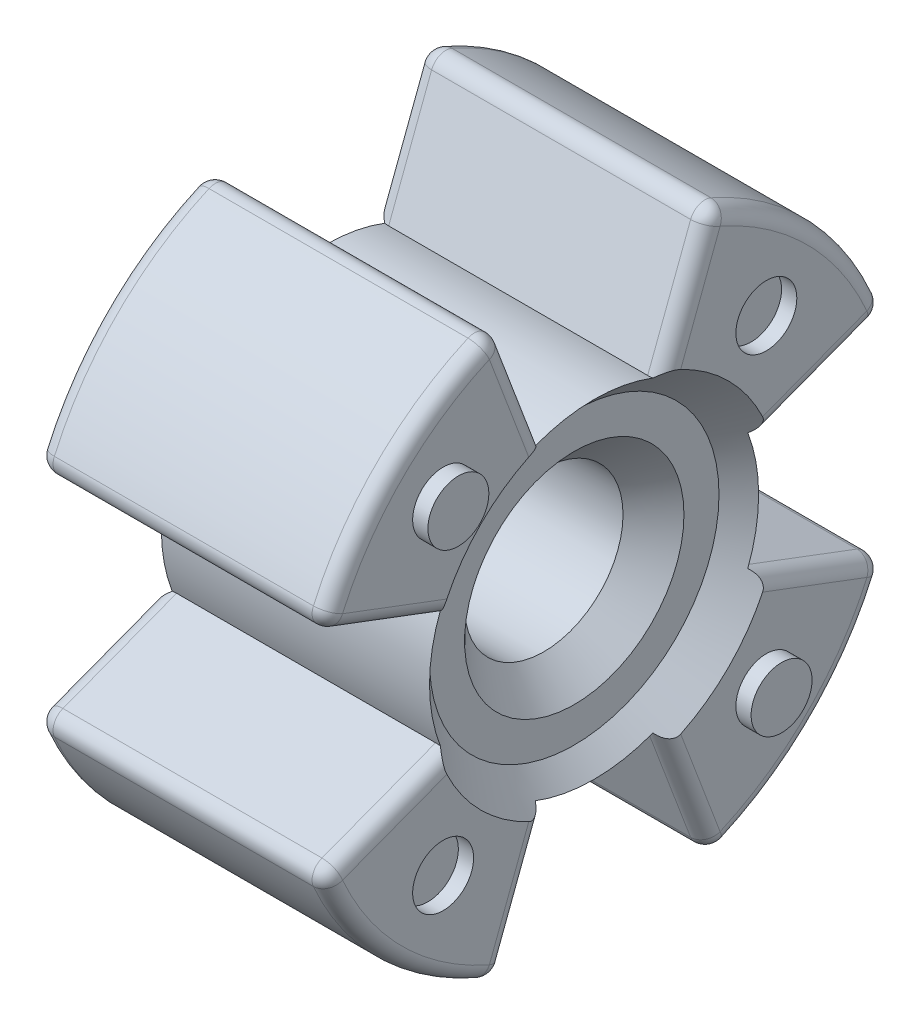
from build123d import *

# Parameters (mm, degrees)
EXTRUDE_1_DEPTH     = 4.75
FILLET_3_R          = 0.5
FILLET_2_R          = 0.5
SKETCH_2_R          = 2.6
CUT_EXTRUDE_1_DEPTH = 17.000196485
SKETCH_3_R          = 4.75
CUT_EXTRUDE_2_DEPTH = 1
CHAMFER_1_SIZE      = 1
CHAMFER_2_SIZE      = 1
CHAMFER_3_SIZE      = 1
SKETCH_4_R          = 1
EXTRUDE_2_DEPTH     = 0.5
SKETCH_5_R          = 1
CUT_EXTRUDE_3_DEPTH = 0.5
SKETCH_7_R          = 1
EXTRUDE_3_DEPTH     = 0.5


with BuildPart() as part:
    # Эскиз1 → Бобышка-Вытянуть1 (new, symmetric)
    with BuildSketch(Plane(origin=(0, 0, 0), x_dir=(0, 0, -1), z_dir=(1, 0, 0))):
        with BuildLine():
            Line((1.909090909, 5.051274285), (3.5, 9.260669522))
            ThreePointArc((3.5, 9.260669522), (7.000357134, 7.000357134), (9.260669522, 3.5))
            Line((9.260669522, 3.5), (5.051274285, 1.909090909))
            ThreePointArc((5.051274285, 1.909090909), (5.4, 0), (5.051274285, -1.909090909))
            Line((5.051274285, -1.909090909), (9.260669522, -3.5))
            ThreePointArc((9.260669522, -3.5), (7.000357134, -7.000357134), (3.5, -9.260669522))
            Line((3.5, -9.260669522), (1.909090909, -5.051274285))
            ThreePointArc((1.909090909, -5.051274285), (0, -5.4), (-1.909090909, -5.051274285))
            Line((-1.909090909, -5.051274285), (-3.5, -9.260669522))
            ThreePointArc((-3.5, -9.260669522), (-7.000357134, -7.000357134), (-9.260669522, -3.5))
            Line((-9.260669522, -3.5), (-5.051274285, -1.909090909))
            ThreePointArc((-5.051274285, -1.909090909), (-5.4, 0), (-5.051274285, 1.909090909))
            Line((-5.051274285, 1.909090909), (-9.260669522, 3.5))
            ThreePointArc((-9.260669522, 3.5), (-7.000357134, 7.000357134), (-3.5, 9.260669522))
            Line((-3.5, 9.260669522), (-1.909090909, 5.051274285))
            ThreePointArc((-1.909090909, 5.051274285), (0, 5.4), (1.909090909, 5.051274285))
        make_face()
    extrude(amount=EXTRUDE_1_DEPTH, both=True)

    # Скругление3
    fillet_3_edges = [part.edges().sort_by_distance(p)[0] for p in [
        (0, 3.5, 9.260669522),
        (0, 9.260669522, 3.5),
        (0, 9.260669522, -3.5),
        (0, 3.5, -9.260669522),
        (0, -3.5, -9.260669522),
        (0, -9.260669522, -3.5),
        (0, -9.260669522, 3.5),
        (0, -3.5, 9.260669522),
    ]]
    fillet(fillet_3_edges, radius=FILLET_3_R)

    # Скругление2
    fillet_2_edges = [part.edges().sort_by_distance(p)[0] for p in [
        (4.75, -6.915892651, 2.613809317),
        (-4.75, 2.613809317, 6.915892651),
        (-4.75, 6.915892651, 2.613809317),
        (-4.75, 6.915892651, -2.613809317),
        (-4.75, 2.613809317, -6.915892651),
        (-4.75, -2.613809317, -6.915892651),
        (-4.75, -6.915892651, -2.613809317),
        (-4.75, -6.915892651, 2.613809317),
        (4.75, -6.915892651, -2.613809317),
        (-4.75, -2.613809317, 6.915892651),
        (4.75, -2.613809317, -6.915892651),
        (4.75, 2.613809317, -6.915892651),
        (4.75, 6.915892651, -2.613809317),
        (4.75, 6.915892651, 2.613809317),
        (-4.75, 7.000357134, -7.000357134),
        (4.75, 7.000357134, -7.000357134),
        (-4.75, 7.000357134, 7.000357134),
        (-4.75, -7.000357134, -7.000357134),
        (4.75, 2.613809317, 6.915892651),
        (-4.75, -7.000357134, 7.000357134),
        (-4.75, 3.5927078, 9.064770393),
        (-4.75, 9.064770393, 3.5927078),
        (-4.75, 9.064770393, -3.5927078),
        (-4.75, -3.5927078, 9.064770393),
        (-4.75, -9.064770393, 3.5927078),
        (-4.75, -9.064770393, -3.5927078),
        (-4.75, -3.5927078, -9.064770393),
        (-4.75, 3.5927078, -9.064770393),
        (4.75, -7.000357134, 7.000357134),
        (4.75, -7.000357134, -7.000357134),
        (4.75, 7.000357134, 7.000357134),
        (4.75, 3.5927078, 9.064770393),
        (4.75, 9.064770393, 3.5927078),
        (4.75, 9.064770393, -3.5927078),
        (4.75, -3.5927078, 9.064770393),
        (4.75, -9.064770393, 3.5927078),
        (4.75, -9.064770393, -3.5927078),
        (4.75, -3.5927078, -9.064770393),
        (4.75, 3.5927078, -9.064770393),
        (4.75, -2.613809317, 6.915892651),
    ]]
    fillet(fillet_2_edges, radius=FILLET_2_R)

    # Эскиз2 → Вырез-Вытянуть1 (cut, through all)
    with BuildSketch(Plane(origin=(4.75, 0, 0), x_dir=(0, 0, -1), z_dir=(1, 0, 0))):
        Circle(SKETCH_2_R)
    extrude(amount=-CUT_EXTRUDE_1_DEPTH, mode=Mode.SUBTRACT)

    # Эскиз3 → Вырез-Вытянуть2 (cut)
    with BuildSketch(Plane(origin=(4.75, 0, 0), x_dir=(0, 0, -1), z_dir=(1, 0, 0))):
        Circle(SKETCH_3_R)
    cut_extrude_2 = extrude(amount=-CUT_EXTRUDE_2_DEPTH, mode=Mode.SUBTRACT)

    # Фаска1
    # the kernel refuses this chamfer: 1 mm, written as the material it takes off along each edge
    with BuildSketch(Plane(origin=(4.75, 0, 0), x_dir=(0, 0, -1), z_dir=(0, -1, 0))) as chamfer_1_piece_1_section:
        Polygon((4.75 + CHAMFER_1_SIZE, 0), (4.75, -CHAMFER_1_SIZE), (4.75, 0), align=None)
    chamfer_1_piece_1 = revolve(axis=Axis((4.75, 0, 0), (1, 0, 0)), mode=Mode.PRIVATE)
    chamfer_1_piece_1 = split(chamfer_1_piece_1, bisect_by=Plane(origin=(3.75, 0, 5.245772043), z_dir=(1, 0, 0)), keep=Keep.TOP, mode=Mode.PRIVATE)
    add(chamfer_1_piece_1, mode=Mode.SUBTRACT)

    # Зеркальное отражение7: Вырез-Вытянуть2 across plane
    add(cut_extrude_2.mirror(Plane(origin=(0, 0, 0), x_dir=(0, 0, 1), z_dir=(1, 0, 0))), mode=Mode.SUBTRACT)

    # Фаска2
    # the kernel refuses this chamfer: 1 mm, written as the material it takes off along each edge
    with BuildSketch(Plane(origin=(-4.75, 0, 0), x_dir=(0, 0, -1), z_dir=(0, -1, 0))) as chamfer_2_piece_1_section:
        Polygon((4.75 + CHAMFER_2_SIZE, 0), (4.75, CHAMFER_2_SIZE), (4.75, 0), align=None)
    chamfer_2_piece_1 = revolve(axis=Axis((-4.75, 0, 0), (1, 0, 0)), mode=Mode.PRIVATE)
    chamfer_2_piece_1 = split(chamfer_2_piece_1, bisect_by=Plane(origin=(-3.75, 0, 5.245772043), z_dir=(-1, 0, 0)), keep=Keep.TOP, mode=Mode.PRIVATE)
    add(chamfer_2_piece_1, mode=Mode.SUBTRACT)

    # Фаска3
    chamfer_3_edges = [part.edges().sort_by_distance(p)[0] for p in [
        (3.75, 0, 2.6),
        (-3.75, 0, 2.6),
    ]]
    chamfer(chamfer_3_edges, length=CHAMFER_3_SIZE)

    # Эскиз4 → Бобышка-Вытянуть2 (add)
    with BuildSketch(Plane(origin=(4.75, 0, 0), x_dir=(0, 0, -1), z_dir=(1, 0, 0))):
        with Locations((-5.303300859, 5.303300859)):
            Circle(SKETCH_4_R)
        with Locations((5.303300859, -5.303300859)):
            Circle(SKETCH_4_R)
    extrude(amount=EXTRUDE_2_DEPTH)

    # Эскиз5 → Вырез-Вытянуть3 (cut)
    with BuildSketch(Plane(origin=(4.75, 0, 0), x_dir=(0, 0, -1), z_dir=(1, 0, 0))):
        with Locations((-5.303300859, -5.303300859)):
            Circle(SKETCH_5_R)
        with Locations((5.303300859, 5.303300859)):
            Circle(SKETCH_5_R)
    extrude(amount=-CUT_EXTRUDE_3_DEPTH, mode=Mode.SUBTRACT)

    # Эскиз7 → Бобышка-Вытянуть3 (add)
    with BuildSketch(Plane.ZY.offset(4.75)):
        with Locations(Location((5.303300859, -5.303300859, 0), (0, 0, 180))):
            Circle(SKETCH_7_R)
        with Locations(Location((-5.303300859, 5.303300859, 0), (0, 0, 180))):
            Circle(SKETCH_7_R)
    extrude(amount=EXTRUDE_3_DEPTH)


solid = part.part
